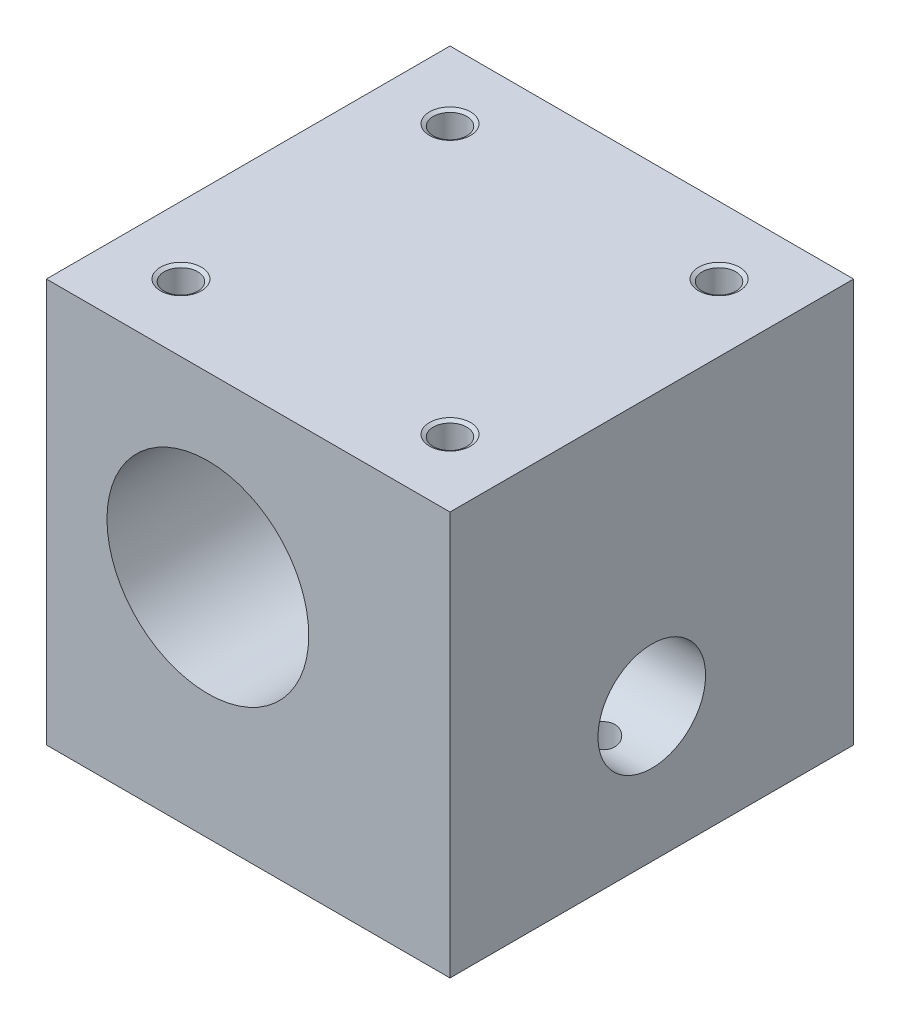
from build123d import *

# Parameters (mm, degrees)
SCHIZZO1_W                      = 30
SCHIZZO1_H                      = 30
SCHIZZO1_R                      = 7.5
ESTRUSIONE_ESTRUSIONE1_DEPTH    = 30
FORO_8_0_8_1_D                  = 8
FORO_8_0_8_1_DEPTH              = 10
FORO_8_0_8_1_TIP                = 2.403442476
FORO_FILETTATO_M3_1_AT_2_COUNT  = 2
FORO_FILETTATO_M3_1_AT_2_PITCH  = 20
FORO_FILETTATO_M3_2_D           = 2.5
FORO_FILETTATO_M3_2_DEPTH       = 8.5
FORO_FILETTATO_M3_2_CSINK_D     = 3.05
FORO_FILETTATO_M3_2_CSINK_ANGLE = 120
FORO_FILETTATO_M3_2_TIP         = 0.751075774


with BuildPart() as part:
    # Schizzo1 → Estrusione-Estrusione1 (new body)
    with BuildSketch(Plane.XY):
        with Locations((15, 15)):
            Rectangle(SCHIZZO1_W, SCHIZZO1_H)
        with Locations((12, 16.8)):
            Circle(SCHIZZO1_R, mode=Mode.SUBTRACT)
    extrude(amount=ESTRUSIONE_ESTRUSIONE1_DEPTH)

    # Foro Ø8.0 (8)-1
    with Locations(Plane(origin=(30, 0, 0), x_dir=(0, 0, -1), z_dir=(1, 0, 0))):
        with Locations((-15, 10)):
            Hole(FORO_8_0_8_1_D / 2, depth=FORO_8_0_8_1_DEPTH)
            with Locations((0, 0, -(FORO_8_0_8_1_DEPTH + FORO_8_0_8_1_TIP / 2))):  # 118° drill point
                Cone(0, FORO_8_0_8_1_D / 2, FORO_8_0_8_1_TIP, mode=Mode.SUBTRACT)

    # Schizzo7 → Foro filettato M3-1 (revolve, cut)
    with BuildSketch(Plane(origin=(5, 30, 25), x_dir=(0, 0, 1), z_dir=(1, 0, 0))):
        Polygon((0, 0), (0, 9.251075774), (1.25, 8.5), (1.25, 0.158771324), (1.525, 0), align=None)
    foro_filettato_m3_1 = revolve(axis=Axis((5, 36.35, 25), (0, -1, 0)), mode=Mode.SUBTRACT)

    # Foro filettato M3-1 at 2: Foro filettato M3-1 ×2
    with Locations(*[(i * FORO_FILETTATO_M3_1_AT_2_PITCH, 0, 0) for i in range(1, FORO_FILETTATO_M3_1_AT_2_COUNT)]):
        add(foro_filettato_m3_1, mode=Mode.SUBTRACT)

    # Specchia1: Foro filettato M3-1 across plane
    add(foro_filettato_m3_1.mirror(Plane.XY.offset(15)), mode=Mode.SUBTRACT)

    # Specchia1 copy 1 sketch → Specchia1 copy 1 (revolve, cut)
    with BuildSketch(Plane(origin=(25, 30, 5), x_dir=(0, 0, -1), z_dir=(1, 0, 0))):
        Polygon((0, 0), (0, -9.251075774), (1.25, -8.5), (1.25, -0.158771324), (1.525, 0), align=None)
    revolve(axis=Axis((25, 36.35, 5), (0, 1, 0)), mode=Mode.SUBTRACT)

    # Foro filettato M3-2
    with Locations(Plane(origin=(0, 0, 0), x_dir=(-1, 0, 0), z_dir=(0, -1, 0))):
        with Locations((-26, -15)):
            CounterSinkHole(FORO_FILETTATO_M3_2_D / 2, FORO_FILETTATO_M3_2_CSINK_D / 2, depth=FORO_FILETTATO_M3_2_DEPTH, counter_sink_angle=FORO_FILETTATO_M3_2_CSINK_ANGLE)
            with Locations((0, 0, -(FORO_FILETTATO_M3_2_DEPTH + FORO_FILETTATO_M3_2_TIP / 2))):  # 118° drill point
                Cone(0, FORO_FILETTATO_M3_2_D / 2, FORO_FILETTATO_M3_2_TIP, mode=Mode.SUBTRACT)


solid = part.part
